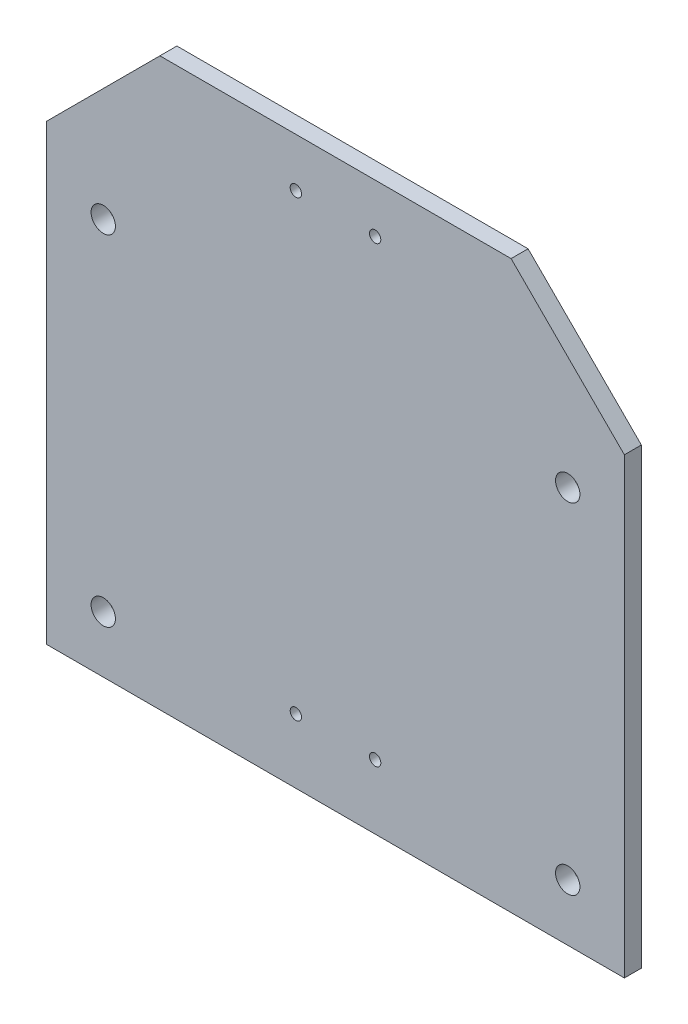
from build123d import *

# Parameters (mm, degrees)
EXTRUDE_1_DEPTH     = 3
SKETCH_2_R          = 2.15
CUT_EXTRUDE_1_DEPTH = 3
SKETCH_3_R          = 1
CUT_EXTRUDE_2_DEPTH = 70


with BuildPart() as part:
    # 草图1 → 凸台-拉伸1 (new body)
    with BuildSketch(Plane.XY):
        Polygon((-51.0025, -60.127538713), (51.0025, -60.127538713), (51.0025, 19.872461287), (31.0025, 39.872461287), (-31.0025, 39.872461287), (-51.0025, 19.872461287), align=None)
    extrude(amount=-EXTRUDE_1_DEPTH)

    # 草图2 → 切除-拉伸1 (cut)
    with BuildSketch(Plane.XY):
        with Locations((-41.0025, 9.872461287)):
            Circle(SKETCH_2_R)
        with Locations((-41.0025, -50.127538713)):
            Circle(SKETCH_2_R)
        with Locations((41.0025, 9.872461287)):
            Circle(SKETCH_2_R)
        with Locations((41.0025, -50.127538713)):
            Circle(SKETCH_2_R)
    extrude(amount=-CUT_EXTRUDE_1_DEPTH, mode=Mode.SUBTRACT)

    # 草图3 → 切除-拉伸2 (cut)
    with BuildSketch(Plane(origin=(0, 0, -3), x_dir=(-1, 0, 0), z_dir=(0, 0, -1))):
        with Locations((-7.000166, 31.249999999)):
            Circle(SKETCH_3_R)
        with Locations((6.999834, 31.249999999)):
            Circle(SKETCH_3_R)
        with Locations((-7.000166, -48.750000001)):
            Circle(SKETCH_3_R)
        with Locations((6.999834, -48.750000001)):
            Circle(SKETCH_3_R)
    extrude(amount=-CUT_EXTRUDE_2_DEPTH, mode=Mode.SUBTRACT)


solid = part.part
